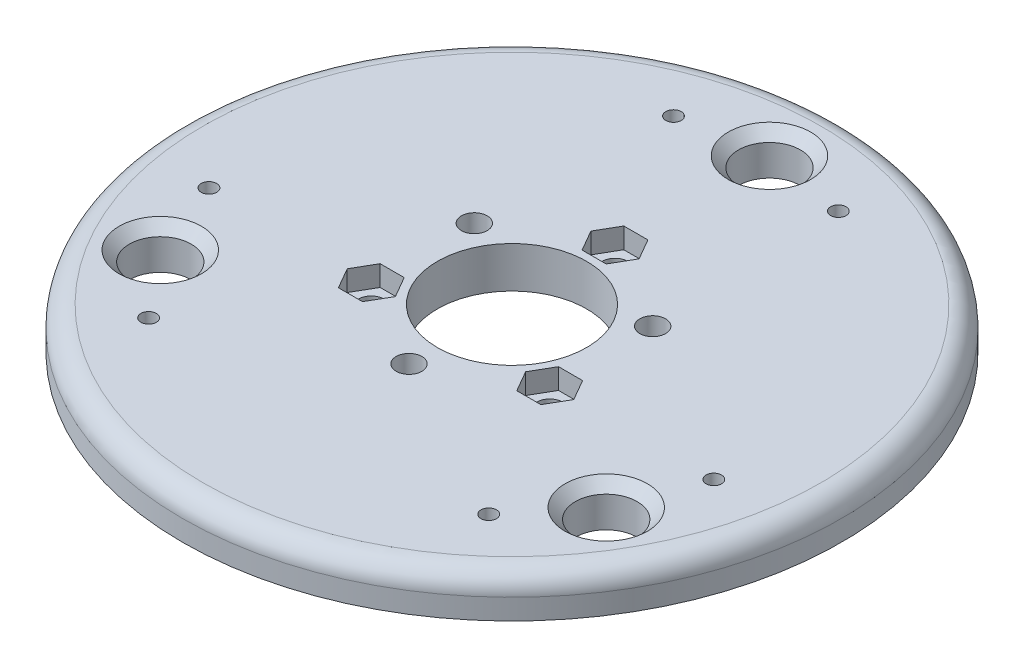
from build123d import *

# Parameters (mm, degrees)
SKETCH_1_R          = 32
SKETCH_1_R_2        = 7.25
SKETCH_1_R_3        = 3
EXTRUDE_1_DEPTH     = 4
FILLET_1_R          = 2
SKETCH_2_R          = 1.25
CUT_EXTRUDE_1_DEPTH = 46.431266766
CUT_EXTRUDE_2_DEPTH = 2
CUT_EXTRUDE_3_DEPTH = 2
CHAMFER_1_SIZE      = 1
SKETCH_5_R          = 0.75
CUT_EXTRUDE_4_DEPTH = 46.431266766


with BuildPart() as part:
    # Эскиз1 → Бобышка-Вытянуть1 (new body)
    with BuildSketch(Plane(origin=(0, 0, 0), x_dir=(1, 0, 0), z_dir=(0, 1, 0))):
        Circle(SKETCH_1_R)
        Circle(SKETCH_1_R_2, mode=Mode.SUBTRACT)
        with Locations((0, 25)):
            Circle(SKETCH_1_R_3, mode=Mode.SUBTRACT)
        with Locations((21.650635095, -12.5)):
            Circle(SKETCH_1_R_3, mode=Mode.SUBTRACT)
        with Locations((-21.650635095, -12.5)):
            Circle(SKETCH_1_R_3, mode=Mode.SUBTRACT)
    extrude(amount=EXTRUDE_1_DEPTH)

    # Скругление1
    fillet_1_edges = [part.edges().sort_by_distance(p)[0] for p in [
        (-32, 4, 0),
    ]]
    fillet(fillet_1_edges, radius=FILLET_1_R)

    # Эскиз2 → Вырез-Вытянуть1 (cut, through all)
    with BuildSketch(Plane(origin=(0, 4, 0), x_dir=(1, 0, 0), z_dir=(0, 1, 0))):
        with Locations((0, 10)):
            Circle(SKETCH_2_R)
        with Locations((8.660254038, 5)):
            Circle(SKETCH_2_R)
        with Locations((8.660254038, -5)):
            Circle(SKETCH_2_R)
        with Locations((0, -10)):
            Circle(SKETCH_2_R)
        with Locations((-8.660254038, -5)):
            Circle(SKETCH_2_R)
        with Locations((-8.660254038, 5)):
            Circle(SKETCH_2_R)
    extrude(amount=-CUT_EXTRUDE_1_DEPTH, mode=Mode.SUBTRACT)

    # Эскиз3 → Вырез-Вытянуть2 (cut)
    with BuildSketch(Plane(origin=(0, 4, 0), x_dir=(1, 0, 0), z_dir=(0, 1, 0))):
        Polygon((9.829388333, -7.025), (10.998522628, -5), (9.829388333, -2.975), (7.491119743, -2.975), (6.321985448, -5), (7.491119743, -7.025), align=None)
        Polygon((1.169134295, 7.975), (2.33826859, 10), (1.169134295, 12.025), (-1.169134295, 12.025), (-2.33826859, 10), (-1.169134295, 7.975), align=None)
        Polygon((-10.998522628, -5), (-9.829388333, -7.025), (-7.491119743, -7.025), (-6.321985448, -5), (-7.491119743, -2.975), (-9.829388333, -2.975), align=None)
    extrude(amount=-CUT_EXTRUDE_2_DEPTH, mode=Mode.SUBTRACT)

    # Эскиз4 → Вырез-Вытянуть3 (cut)
    with BuildSketch(Plane.XZ):
        Polygon((7.491119743, -7.025), (9.829388333, -7.025), (10.998522628, -5), (9.829388333, -2.975), (7.491119743, -2.975), (6.321985448, -5), align=None)
        Polygon((-1.169134295, 7.975), (1.169134295, 7.975), (2.33826859, 10), (1.169134295, 12.025), (-1.169134295, 12.025), (-2.33826859, 10), align=None)
        Polygon((-9.829388333, -2.975), (-10.998522628, -5), (-9.829388333, -7.025), (-7.491119743, -7.025), (-6.321985448, -5), (-7.491119743, -2.975), align=None)
    extrude(amount=-CUT_EXTRUDE_3_DEPTH, mode=Mode.SUBTRACT)

    # Фаска1
    chamfer_1_edges = [part.edges().sort_by_distance(p)[0] for p in [
        (-3, 4, -25),
        (-24.650635095, 4, 12.5),
        (18.650635095, 4, 12.5),
    ]]
    chamfer(chamfer_1_edges, length=CHAMFER_1_SIZE)

    # Эскиз5 → Вырез-Вытянуть4 (cut, through all)
    with BuildSketch(Plane(origin=(0, 4, 0), x_dir=(1, 0, 0), z_dir=(0, 1, 0))):
        with Locations((8, 23.685438565)):
            Circle(SKETCH_5_R)
        with Locations((-8, 23.685438565)):
            Circle(SKETCH_5_R)
        with Locations((24.512191497, -4.914516052)):
            Circle(SKETCH_5_R)
        with Locations((16.512191497, -18.770922513)):
            Circle(SKETCH_5_R)
        with Locations((-16.512191497, -18.770922513)):
            Circle(SKETCH_5_R)
        with Locations((-24.512191497, -4.914516052)):
            Circle(SKETCH_5_R)
    extrude(amount=-CUT_EXTRUDE_4_DEPTH, mode=Mode.SUBTRACT)


solid = part.part
